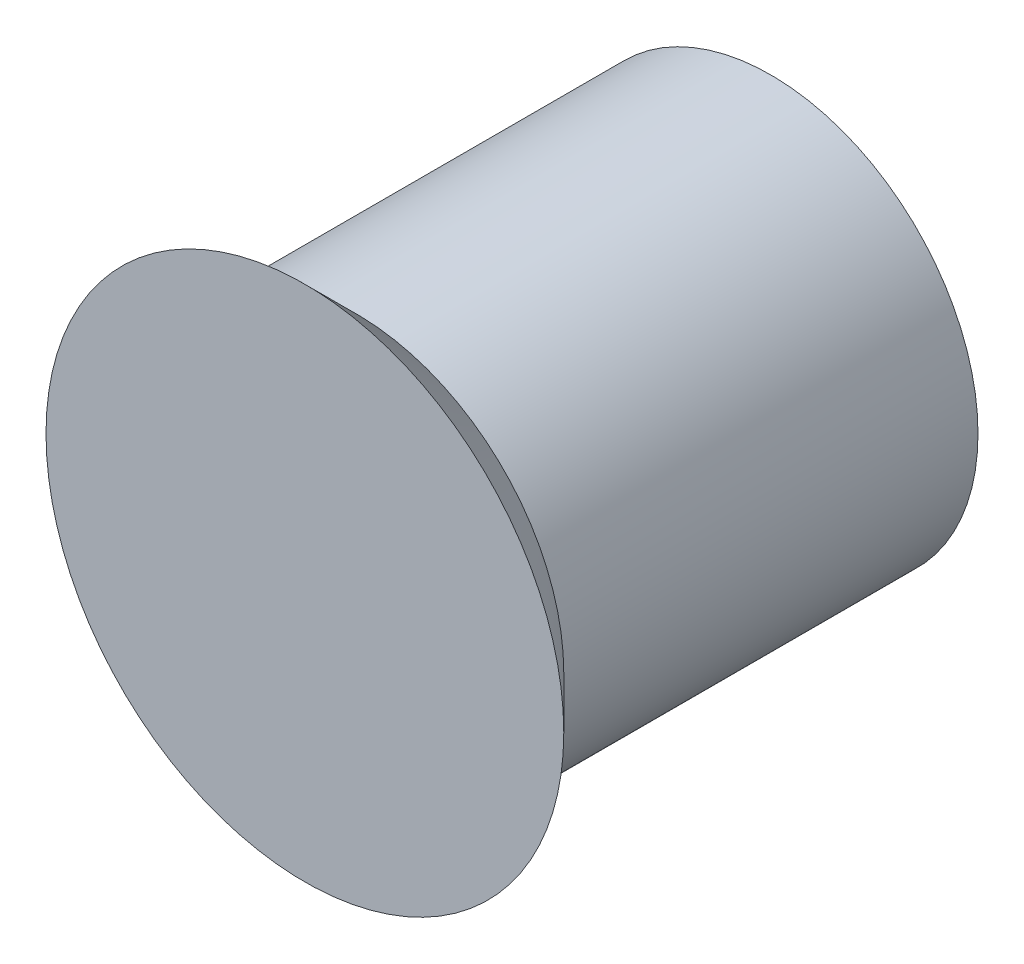
from build123d import *

# Parameters (mm, degrees)
IZIM1_R                     = 4
Y_KSEKLIK_EKSTR_ZYON1_DEPTH = 8
IZIM2_R                     = 4
Y_KSEKLIK_EKSTR_ZYON2_DEPTH = 1
Y_KSEKLIK_EKSTR_ZYON2_DRAFT = -45


with BuildPart() as part:
    # Çizim1 → Yükseklik-Ekstrüzyon1 (new body)
    with BuildSketch(Plane.XY):
        Circle(IZIM1_R)
    extrude(amount=Y_KSEKLIK_EKSTR_ZYON1_DEPTH)


with BuildPart() as y_kseklik_ekstr_zyon2_tool:
    # Çizim2 → Yükseklik-Ekstrüzyon2 (with draft: the straight prism first)
    with BuildSketch(Plane.XY.offset(8)):
        Circle(IZIM2_R)
    extrude(amount=Y_KSEKLIK_EKSTR_ZYON2_DEPTH)
    # Yükseklik-Ekstrüzyon2: the draft: its side faces are tilted about the plane it starts from
    y_kseklik_ekstr_zyon2_sides = [y_kseklik_ekstr_zyon2_tool.faces().sort_by_distance(p)[0] for p in [
        (-4, 0, 8.5),
    ]]
    draft(y_kseklik_ekstr_zyon2_sides, Plane.XY.offset(8), Y_KSEKLIK_EKSTR_ZYON2_DRAFT)


with BuildPart() as part_1:
    add(part.part)

    # Yükseklik-Ekstrüzyon2: add y_kseklik_ekstr_zyon2_tool
    add(y_kseklik_ekstr_zyon2_tool.part)


solid = part_1.part
